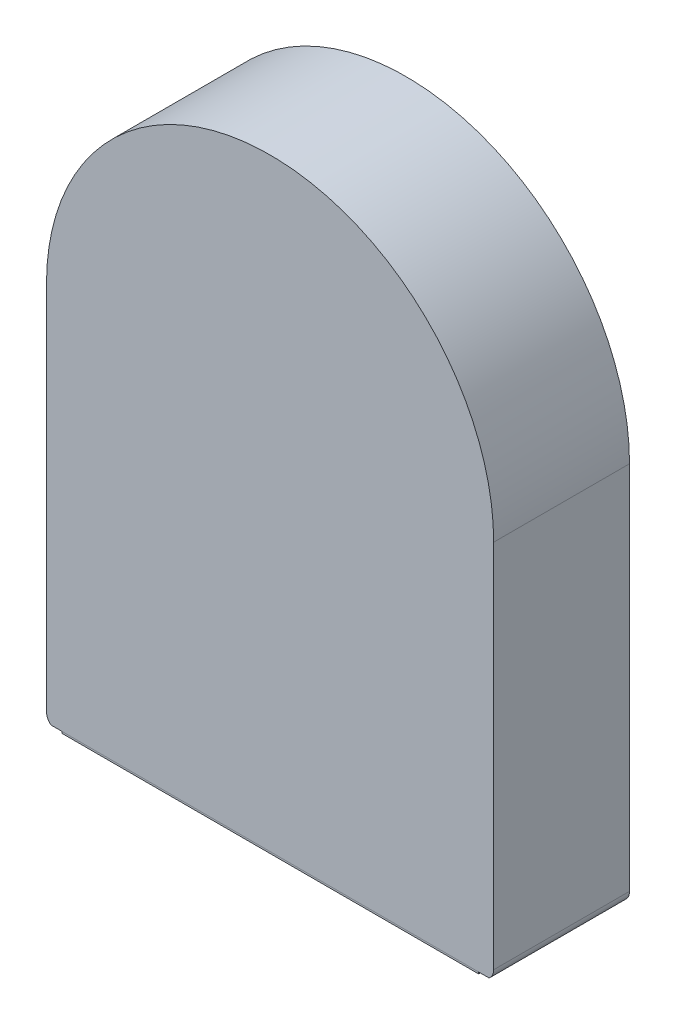
from build123d import *

# Parameters (mm, degrees)
EXTRUDE_1_DEPTH = 5.65
FILLET_1_R      = 0.5
OTHER_START     = -9.109345257
OTHER_1_DEPTH   = 18.218690514
OTHER_1_2_DEPTH = 0.442344722
OTHER_START_2   = 8.668200897
OTHER_1_3_DEPTH = 0.44114436


# Read off the part's stored shape, not the designer's step: 型腔1
with BuildPart() as part:
    # 草图1 → 凸台-拉伸1 (new body)
    with BuildSketch(Plane.XY):
        with BuildLine():
            Line((-9.3, 0), (-9.3, -15.9))
            Line((-9.3, -15.9), (9.3, -15.9))
            Line((9.3, -15.9), (9.3, 0))
            ThreePointArc((9.3, 0), (0, 9.3), (-9.3, 0))
        make_face()
    extrude(amount=EXTRUDE_1_DEPTH)

    # 圆角1
    fillet_1_edges = [part.edges().sort_by_distance(p)[0] for p in [
        (9.3, -15.9, 2.825),
        (-9.3, -15.9, 2.825),
    ]]
    fillet(fillet_1_edges, radius=FILLET_1_R)

    # 型腔1 outline → 型腔1 (cut)
    with BuildSketch(Plane.YZ.offset(OTHER_START)):
        Polygon((-15.873817403, 5.640486893), (-15.792817403, 5.640486893), (-15.792817403, 5.65), (-15.9, 5.65), (-15.9, 5.521595656), (-15.873817403, 5.54823926), align=None)
    extrude(amount=OTHER_1_DEPTH, mode=Mode.SUBTRACT)

    # Other 1 2 outline → Other 1 2 (cut)
    with BuildSketch(Plane.YZ.offset(OTHER_START)):
        Polygon((-15.873817403, 5.54823926), (-15.792817403, 5.63066546), (-15.792817403, 5.640486893), (-15.873817403, 5.640486893), align=None)
    extrude(amount=OTHER_1_2_DEPTH, mode=Mode.SUBTRACT)

    # Other 1 3 outline → Other 1 3 (cut)
    with BuildSketch(Plane.YZ.offset(OTHER_START_2)):
        Polygon((-15.873817403, 5.54823926), (-15.792817403, 5.63066546), (-15.792817403, 5.640486893), (-15.873817403, 5.640486893), align=None)
    extrude(amount=OTHER_1_3_DEPTH, mode=Mode.SUBTRACT)


solid = part.part
